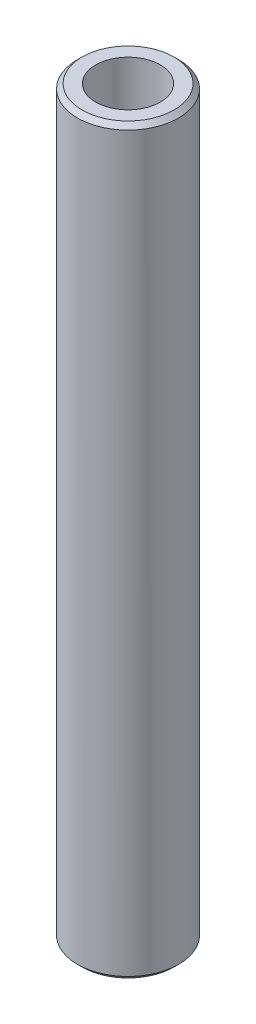
from build123d import *

# Parameters (mm, degrees)
SKETCH1_R           = 20
BOSS_EXTRUDE1_DEPTH = 293.418691403
SKETCH2_R           = 12.766320234
CUT_EXTRUDE1_DEPTH  = 295.778778858
CHAMFER1_SIZE       = 1.826921719


with BuildPart() as part:
    # Sketch1 → Boss-Extrude1 (new body)
    with BuildSketch(Plane(origin=(0, 0, 0), x_dir=(1, 0, 0), z_dir=(0, 1, 0))):
        Circle(SKETCH1_R)
    extrude(amount=BOSS_EXTRUDE1_DEPTH)

    # Sketch2 → Cut-Extrude1 (cut, through all)
    with BuildSketch(Plane(origin=(0, 0, 0), x_dir=(1, 0, 0), z_dir=(0, 1, 0))):
        Circle(SKETCH2_R)
    extrude(amount=CUT_EXTRUDE1_DEPTH, mode=Mode.SUBTRACT)

    # Chamfer1
    chamfer1_edges = [part.edges().sort_by_distance(p)[0] for p in [
        (-20, 293.418691403, 0),
        (-20, 0, 0),
    ]]
    chamfer(chamfer1_edges, length=CHAMFER1_SIZE)


solid = part.part
